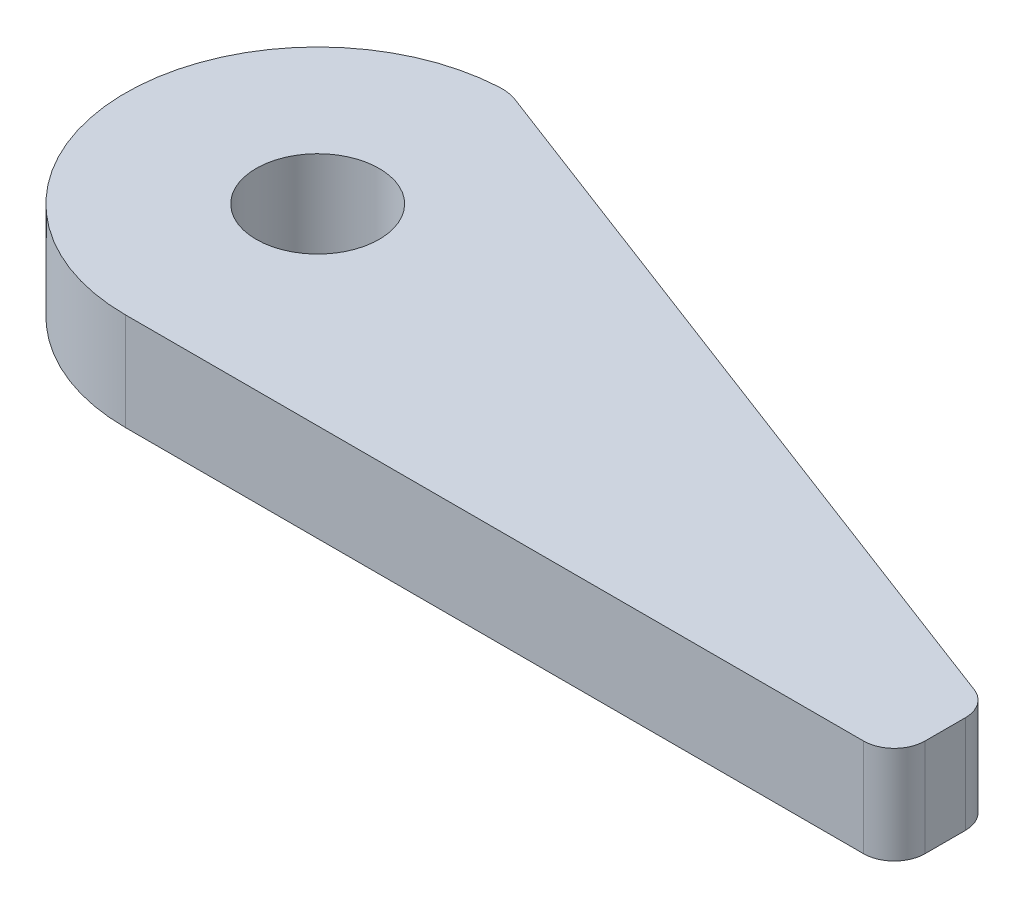
from build123d import *

# Parameters (mm, degrees)
SKETCH1_R           = 4
BOSS_EXTRUDE1_DEPTH = 6.35
FILLET1_R           = 2
FILLET2_R           = 3


with BuildPart() as part:
    # Sketch1 → Boss-Extrude1 (new body)
    with BuildSketch(Plane(origin=(0, 0, 0), x_dir=(1, 0, 0), z_dir=(0, 1, 0))):
        with BuildLine():
            Line((0, -12.5), (50, -12.5))
            Line((50, -12.5), (50, -6.5))
            Line((50, -6.5), (0, 12.5))
            ThreePointArc((0, 12.5), (-12.5, 0), (0, -12.5))
        make_face()
        Circle(SKETCH1_R, mode=Mode.SUBTRACT)
    extrude(amount=BOSS_EXTRUDE1_DEPTH)

    # Fillet1
    fillet1_edges = [part.edges().sort_by_distance(p)[0] for p in [
        (50, 3.175, 12.5),
        (50, 3.175, 6.5),
    ]]
    fillet(fillet1_edges, radius=FILLET1_R)

    # Fillet2
    fillet2_edges = [part.edges().sort_by_distance(p)[0] for p in [
        (0, 3.175, -12.5),
    ]]
    fillet(fillet2_edges, radius=FILLET2_R)


solid = part.part
